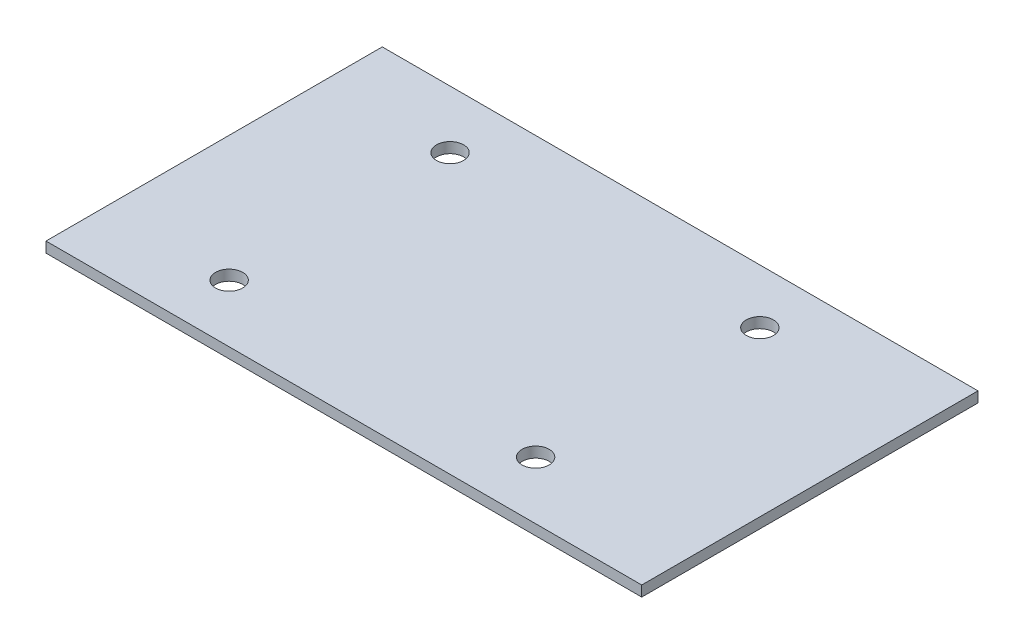
from build123d import *

# Parameters (mm, degrees)
SKETCH1_W           = 180
SKETCH1_H           = 101.6
SKETCH1_R           = 4.1
BOSS_EXTRUDE1_DEPTH = 3.175


with BuildPart() as part:
    # Sketch1 → Boss-Extrude1 (new body)
    with BuildSketch(Plane(origin=(0, 0, 0), x_dir=(1, 0, 0), z_dir=(0, 1, 0))):
        Rectangle(SKETCH1_W, SKETCH1_H)
        with Locations((-52.0875, 33.373488098)):
            Circle(SKETCH1_R, mode=Mode.SUBTRACT)
        with Locations((40.5125, 34.373488098)):
            Circle(SKETCH1_R, mode=Mode.SUBTRACT)
        with Locations((40.5125, -33.373488098)):
            Circle(SKETCH1_R, mode=Mode.SUBTRACT)
        with Locations((-52.0875, -33.373488098)):
            Circle(SKETCH1_R, mode=Mode.SUBTRACT)
    extrude(amount=BOSS_EXTRUDE1_DEPTH)


solid = part.part
